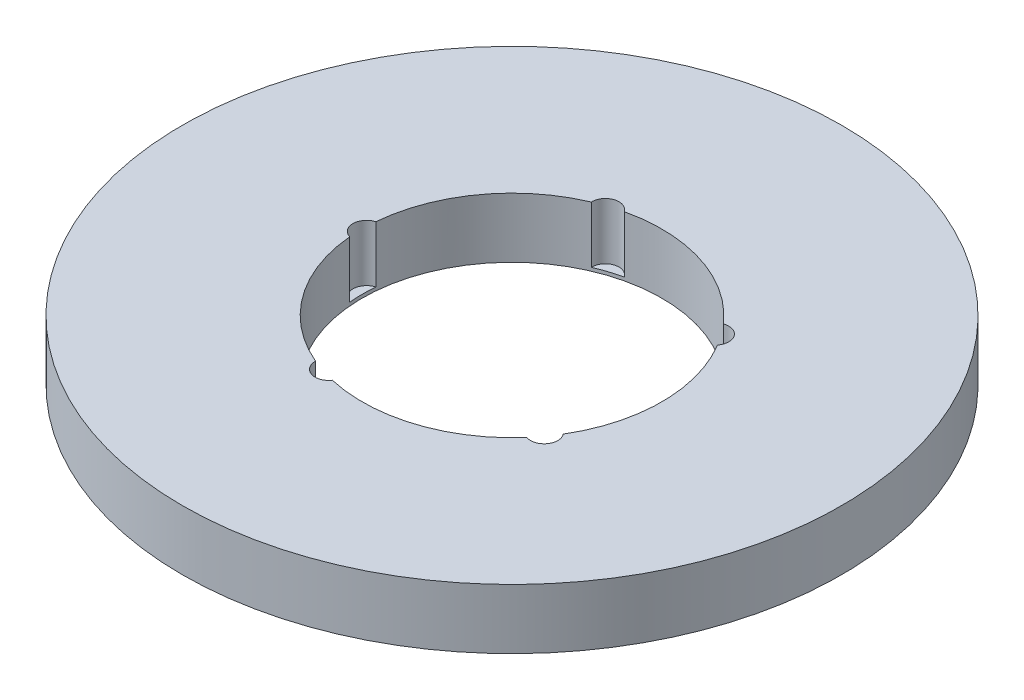
from build123d import *

# Parameters (mm, degrees)
SKETCH1_R           = 55
BOSS_EXTRUDE1_DEPTH = 10
SKETCH2_R           = 25
CUT_EXTRUDE1_DEPTH  = 79.421935707
SKETCH3_R           = 2.270456578
CUT_EXTRUDE2_DEPTH  = 9.439711788
CIRPATTERN1_COUNT   = 5


with BuildPart() as part:
    # Sketch1 → Boss-Extrude1 (new body)
    with BuildSketch(Plane(origin=(0, 0, 0), x_dir=(1, 0, 0), z_dir=(0, 1, 0))):
        Circle(SKETCH1_R)
    extrude(amount=BOSS_EXTRUDE1_DEPTH)

    # Sketch2 → Cut-Extrude1 (cut, through all)
    with BuildSketch(Plane(origin=(0, 0, 0), x_dir=(1, 0, 0), z_dir=(0, 1, 0))):
        Circle(SKETCH2_R)
    extrude(amount=CUT_EXTRUDE1_DEPTH, mode=Mode.SUBTRACT)

    # Sketch3 → Cut-Extrude2 (cut)
    with BuildSketch(Plane(origin=(0, 10, 0), x_dir=(1, 0, 0), z_dir=(0, 1, 0))):
        with Locations((-24.275588231, 0)):
            Circle(SKETCH3_R)
    cut_extrude2 = extrude(amount=-CUT_EXTRUDE2_DEPTH, mode=Mode.SUBTRACT)

    # CirPattern1: Cut-Extrude2 ×5 about axis
    cirpattern1_axis = Axis((0, 0, 0), (0, 1, 0))
    for i in range(1, CIRPATTERN1_COUNT):
        add(cut_extrude2.rotate(cirpattern1_axis, i * 360 / CIRPATTERN1_COUNT), mode=Mode.SUBTRACT)


solid = part.part
